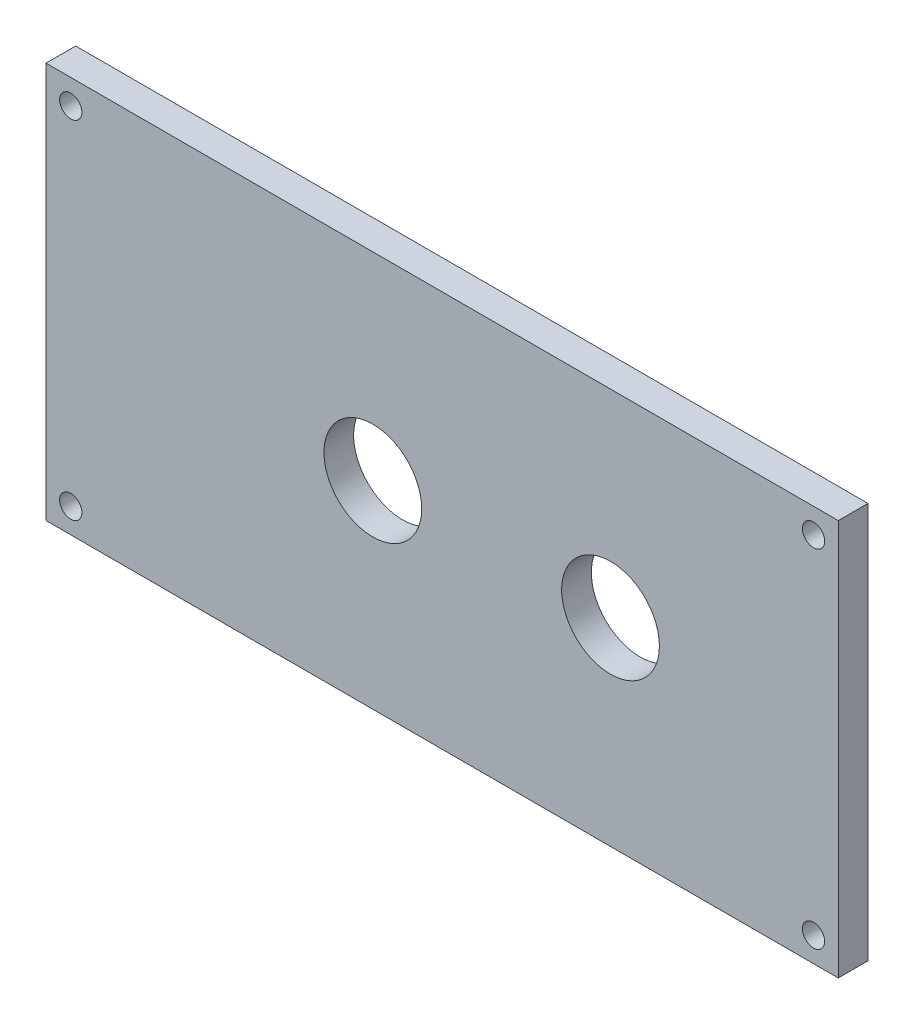
from build123d import *

# Parameters (mm, degrees)
SKETCH1_W           = 80
SKETCH1_H           = 40
BOSS_EXTRUDE1_DEPTH = 3
SKETCH2_R           = 4.9365
SKETCH2_R_2         = 1.125
CUT_EXTRUDE1_DEPTH  = 90.493016487


with BuildPart() as part:
    # Sketch1 → Boss-Extrude1 (new body)
    with BuildSketch(Plane.XY):
        with Locations((40, 20)):
            Rectangle(SKETCH1_W, SKETCH1_H)
    extrude(amount=BOSS_EXTRUDE1_DEPTH)

    # Sketch2 → Cut-Extrude1 (cut, through all)
    with BuildSketch(Plane.XY.offset(3)):
        with Locations((33, 20)):
            Circle(SKETCH2_R)
        with Locations((57, 20)):
            Circle(SKETCH2_R)
        with Locations((2.5, 37.5)):
            Circle(SKETCH2_R_2)
        with Locations((77.5, 37.5)):
            Circle(SKETCH2_R_2)
        with Locations((77.5, 2.5)):
            Circle(SKETCH2_R_2)
        with Locations((2.5, 2.5)):
            Circle(SKETCH2_R_2)
    extrude(amount=-CUT_EXTRUDE1_DEPTH, mode=Mode.SUBTRACT)


solid = part.part
